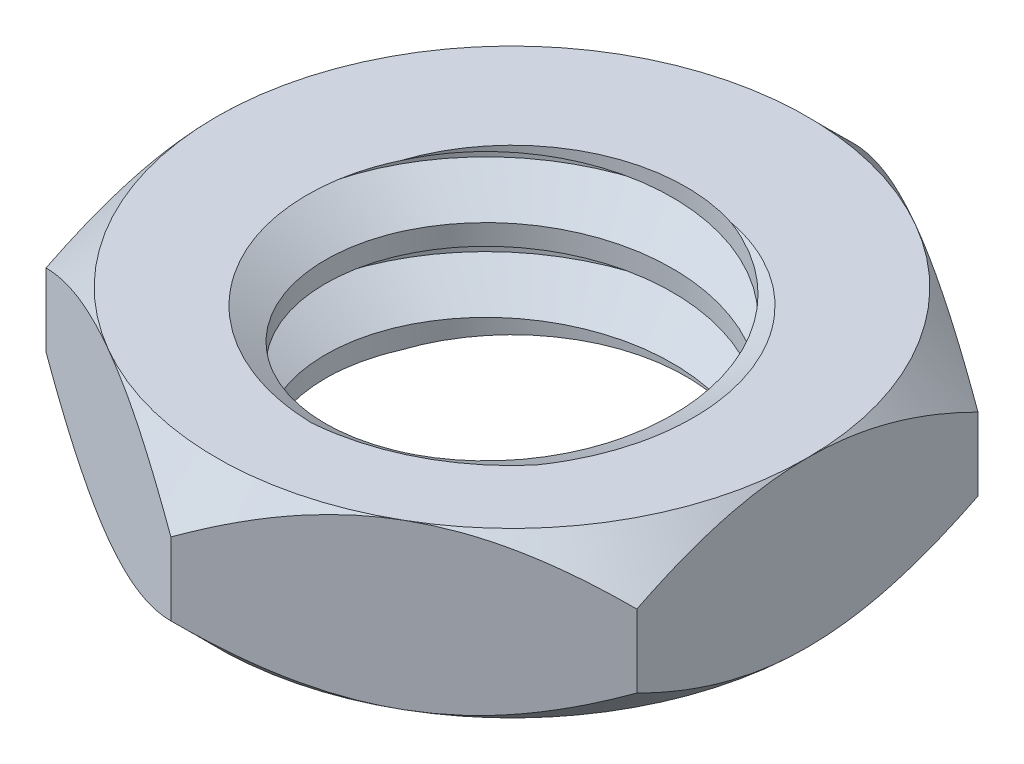
from build123d import *

# Parameters (mm, degrees)
EXTRUDE_1_DEPTH      = 5
SKETCH_2_OUTSIDE_W   = 45.59
SKETCH_2_OUTSIDE_H   = 48.374
SKETCH_2_OUTSIDE_R   = 9
CUT_EXTRUDE_4_DEPTH  = 10
CUT_EXTRUDE_4_DRAFT  = -45
CUT_EXTRUDE_START    = -5
SKETCH_2_2_OUTSIDE_W = 35.59
SKETCH_2_2_OUTSIDE_H = 38.374
SKETCH_2_2_OUTSIDE_R = 9
CUT_EXTRUDE_5_DEPTH  = 5
CUT_EXTRUDE_5_DRAFT  = 45
SKETCH_1_5_R         = 5.3
CUT_EXTRUDE_6_DEPTH  = 15.628738838
THREAD_1_PITCH       = 2.5


with BuildPart() as part:
    # Sketch 1 → 凸台-拉伸1 (new body)
    with BuildSketch(Plane(origin=(0, 0, 0), x_dir=(1, 0, 0), z_dir=(0, 1, 0))):
        Polygon((9, 5.196152423), (0, 10.392304845), (-9, 5.196152423), (-9, -5.196152423), (0, -10.392304845), (9, -5.196152423), align=None)
    extrude(amount=EXTRUDE_1_DEPTH)


with BuildPart() as cut_extrude_4_tool:
    # 草图2 outside → 切除-拉伸4 (with draft: the straight prism first)
    with BuildSketch(Plane(origin=(0, 5, 0), x_dir=(1, 0, 0), z_dir=(0, 1, 0))):
        Rectangle(SKETCH_2_OUTSIDE_W, SKETCH_2_OUTSIDE_H)
        Circle(SKETCH_2_OUTSIDE_R, mode=Mode.SUBTRACT)
    extrude(amount=-CUT_EXTRUDE_4_DEPTH)
    # 切除-拉伸4: the draft: its side faces are tilted about the plane it starts from
    cut_extrude_4_sides = [cut_extrude_4_tool.faces().sort_by_distance(p)[0] for p in [
        (0, 0, 24.187),
        (22.795, 0, 0),
        (0, 0, -24.187),
        (-22.795, 0, 0),
        (-9, 0, 0),
    ]]
    draft(cut_extrude_4_sides, Plane(origin=(0, 5, 0), x_dir=(1, 0, 0), z_dir=(0, 1, 0)), CUT_EXTRUDE_4_DRAFT)


with BuildPart() as part_1:
    add(part.part)

    # 切除-拉伸4: cut by cut_extrude_4_tool
    add(cut_extrude_4_tool.part, mode=Mode.SUBTRACT)


with BuildPart() as cut_extrude_5_tool:
    # 草图2<2> outside → 切除-拉伸5 (with draft: the straight prism first)
    with BuildSketch(Plane(origin=(0, 5, 0), x_dir=(1, 0, 0), z_dir=(0, 1, 0)).offset(CUT_EXTRUDE_START)):
        Rectangle(SKETCH_2_2_OUTSIDE_W, SKETCH_2_2_OUTSIDE_H)
        Circle(SKETCH_2_2_OUTSIDE_R, mode=Mode.SUBTRACT)
    extrude(amount=CUT_EXTRUDE_5_DEPTH)
    # 切除-拉伸5: the draft: its side faces are tilted about the plane it starts from
    cut_extrude_5_sides = [cut_extrude_5_tool.faces().sort_by_distance(p)[0] for p in [
        (0, 2.5, 19.187),
        (17.795, 2.5, 0),
        (0, 2.5, -19.187),
        (-17.795, 2.5, 0),
        (-9, 2.5, 0),
    ]]
    draft(cut_extrude_5_sides, Plane(origin=(0, 5, 0), x_dir=(1, 0, 0), z_dir=(0, 1, 0)).offset(CUT_EXTRUDE_START), CUT_EXTRUDE_5_DRAFT)


with BuildPart() as part_2:
    add(part_1.part)

    # 切除-拉伸5: cut by cut_extrude_5_tool
    add(cut_extrude_5_tool.part, mode=Mode.SUBTRACT)

    # 草图1<5> → 切除-拉伸6 (cut, through all)
    with BuildSketch(Plane(origin=(0, 0, 0), x_dir=(1, 0, 0), z_dir=(0, 1, 0))):
        with Locations(Location((0, 0, 0), (0, 0, 270))):
            Circle(SKETCH_1_5_R)
    extrude(amount=CUT_EXTRUDE_6_DEPTH, mode=Mode.SUBTRACT)

    # 螺纹线1: the profile of Sketch 1 2 profile screwed along a right-hand helix of 3.2 turns, 10 arcs to a turn; built about Z, then put on its axis
    thread_1_z = Axis((0, 0, 0), (0, 0, 1))
    thread_1_corners = [(5.2997, 0, -0.000173205), (6.653164688, 0, 0.781249997), (6.653164688, 0, 1.093749997), (5.2997, 0, 1.875173198)]
    with BuildLine(mode=Mode.PRIVATE) as thread_1_profile:
        Line(thread_1_corners[0], thread_1_corners[1])
        Line(thread_1_corners[1], thread_1_corners[2])
        Line(thread_1_corners[2], thread_1_corners[3])
        Line(thread_1_corners[3], thread_1_corners[0])
    thread_1_cap = Face(thread_1_profile.wire())
    thread_1_turn_angles = [0, 18, 36, 54, 72, 90, 108, 126, 144, 162, 180, 198, 216, 234, 252, 270, 288, 306, 324, 342, 360]
    thread_1_turn_weights = [1, 0.9510565162951535, 1, 0.9510565162951535, 1, 0.9510565162951535, 1, 0.9510565162951535, 1, 0.9510565162951535, 1, 0.9510565162951535, 1, 0.9510565162951535, 1, 0.9510565162951535, 1, 0.9510565162951535, 1, 0.9510565162951535, 1]
    thread_1_turn_rails = [Edge.make_bspline([Vector(p[0], p[1], 0).rotate(thread_1_z, thread_1_turn_angles[k]) / thread_1_turn_weights[k] + Vector(0, 0, p[2] + THREAD_1_PITCH * thread_1_turn_angles[k] / 360) for k in range(21)], [0, 0, 0, 1, 1, 2, 2, 3, 3, 4, 4, 5, 5, 6, 6, 7, 7, 8, 8, 9, 9, 10, 10, 10], 2, thread_1_turn_weights) for p in thread_1_corners]
    thread_1_turn_sides = [Face.make_surface_from_curves(thread_1_turn_rails[p[0]], thread_1_turn_rails[p[1]]) for p in [(0, 1), (1, 2), (2, 3), (3, 0)]]
    thread_1_last_angles = [1080, 1098, 1116, 1134, 1152]
    thread_1_last_weights = [1, 0.9510565162951535, 1, 0.9510565162951542, 1]
    thread_1_last_rails = [Edge.make_bspline([Vector(p[0], p[1], 0).rotate(thread_1_z, thread_1_last_angles[k]) / thread_1_last_weights[k] + Vector(0, 0, p[2] + THREAD_1_PITCH * thread_1_last_angles[k] / 360) for k in range(5)], [0, 0, 0, 1, 1, 2, 2, 2], 2, thread_1_last_weights) for p in thread_1_corners]
    thread_1_last_sides = [Face.make_surface_from_curves(thread_1_last_rails[p[0]], thread_1_last_rails[p[1]]) for p in [(0, 1), (1, 2), (2, 3), (3, 0)]]
    thread_1 = Plane(origin=(0, -3, 0), x_dir=(1, 0, 0), z_dir=(0, 1, 0)) * Solid(Shell([*[p.moved(Location((0, 0, THREAD_1_PITCH * i))) for i in range(3) for p in thread_1_turn_sides], *thread_1_last_sides, thread_1_cap, thread_1_cap.rotate(thread_1_z, 1152).moved(Location((0, 0, THREAD_1_PITCH * 1152 / 360)))]))
    add(thread_1, mode=Mode.SUBTRACT)


solid = part_2.part
